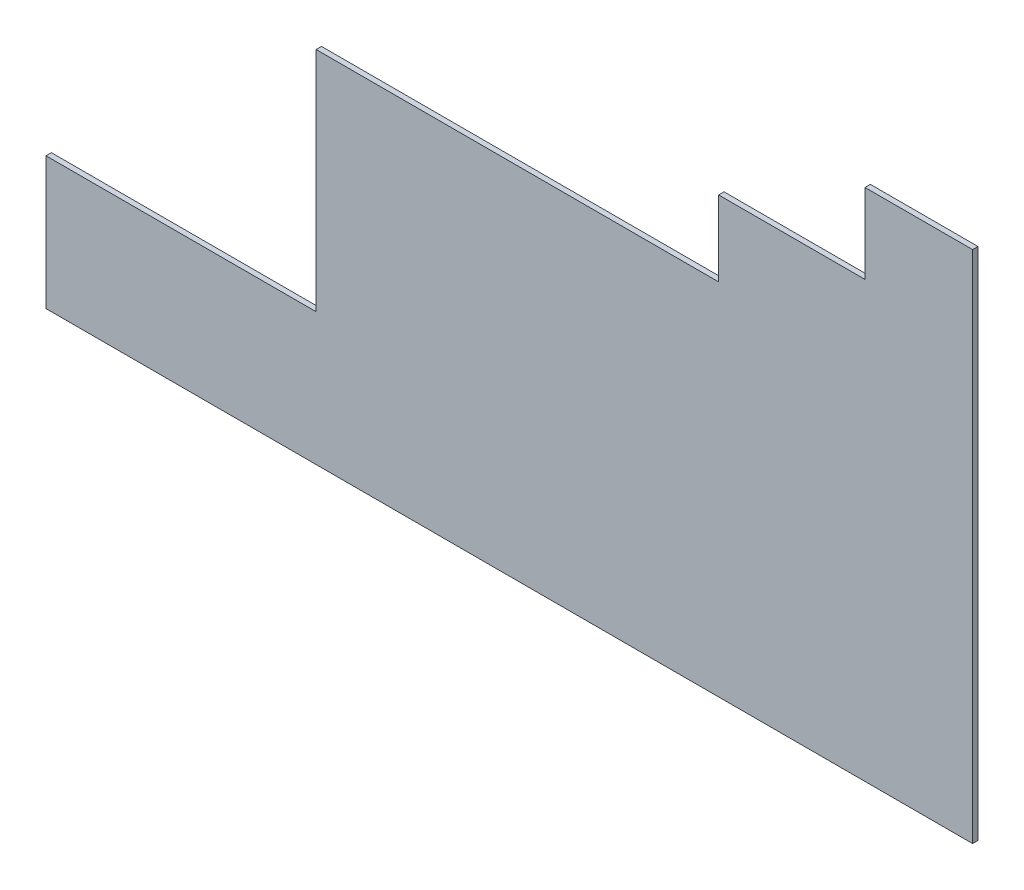
from build123d import *

# Parameters (mm, degrees)
TABAN_FLAN_1_DEPTH         = 25
KES_EKSTR_ZYON1_DEPTH      = 6508.676543898
KES_EKSTR_ZYON1_DEPTH_BACK = 6508.676543898
IZIM7_W                    = 1400
IZIM7_H                    = 1895
IZIM7_W_2                  = 310
IZIM7_H_2                  = 495
KES_EKSTR_ZYON2_DEPTH      = 6508.676543898
KES_EKSTR_ZYON2_DEPTH_BACK = 6508.676543898
IZIM8_W                    = 292
IZIM8_H                    = 2515
KES_EKSTR_ZYON3_DEPTH      = 6240.38698912
KES_EKSTR_ZYON3_DEPTH_BACK = 6240.38698912
IZIM10_W                   = 2900
IZIM10_H                   = 350
KES_EKSTR_ZYON4_DEPTH      = 6240.38698912
KES_EKSTR_ZYON4_DEPTH_BACK = 6240.38698912
KES_EKSTR_ZYON5_DEPTH      = 6191.05856192
KES_EKSTR_ZYON5_DEPTH_BACK = 6191.05856192
IZIM12_W                   = 5
IZIM12_H                   = 615


# Sheet-metal steps are written as plain solids
with BuildPart() as part:
    # Çizim1 → Taban-Flanş1 (new body)
    with BuildSketch(Plane.XY):
        Polygon((0, 0), (0, 1895), (2935, 1895), (2935, 2020), (4900, 2020), (4900, 2515), (6002, 2515), (6002, 0), align=None)
    extrude(amount=-TABAN_FLAN_1_DEPTH)

    # Çizim7 → Kes-Ekstrüzyon1 (cut, two sides: drawn at the far end of the back side and taken through both)
    with BuildSketch(Plane.XY.offset(-KES_EKSTR_ZYON1_DEPTH_BACK)):
        with Locations((700, 947.5)):
            Rectangle(IZIM7_W, IZIM7_H)
        with Locations((5055, 2267.5)):
            Rectangle(IZIM7_W_2, IZIM7_H_2)
    extrude(amount=KES_EKSTR_ZYON1_DEPTH + KES_EKSTR_ZYON1_DEPTH_BACK, mode=Mode.SUBTRACT)

    # Çizim8 → Kes-Ekstrüzyon2 (cut, two sides: drawn at the far end of the back side and taken through both)
    with BuildSketch(Plane.XY.offset(-KES_EKSTR_ZYON2_DEPTH_BACK)):
        with Locations((5856, 1257.5)):
            Rectangle(IZIM8_W, IZIM8_H)
    extrude(amount=KES_EKSTR_ZYON2_DEPTH + KES_EKSTR_ZYON2_DEPTH_BACK, mode=Mode.SUBTRACT)

    # Çizim10 → Kes-Ekstrüzyon3 (cut, two sides: drawn at the far end of the back side and taken through both)
    with BuildSketch(Plane.XY.offset(-KES_EKSTR_ZYON3_DEPTH_BACK)):
        with Locations((2850, 1845)):
            Rectangle(IZIM10_W, IZIM10_H)
    extrude(amount=KES_EKSTR_ZYON3_DEPTH + KES_EKSTR_ZYON3_DEPTH_BACK, mode=Mode.SUBTRACT)

    # Çizim11 → Kes-Ekstrüzyon4 (cut, two sides: drawn at the far end of the back side and taken through both)
    with BuildSketch(Plane.XY.offset(-KES_EKSTR_ZYON4_DEPTH_BACK)):
        Polygon((4300, 1670), (4530, 1670), (4530, 2020), (5210, 2020), (5210, 2390), (5710, 2390), (5778.630385148, 2406.496682207), (5749.815338653, 2697.266696836), (5189.231706845, 2697.266696836), (4530, 2199.552257381), (4300, 2199.552257381), align=None)
    extrude(amount=KES_EKSTR_ZYON4_DEPTH + KES_EKSTR_ZYON4_DEPTH_BACK, mode=Mode.SUBTRACT)

    # Çizim12 → Kes-Ekstrüzyon5 (cut, two sides: drawn at the far end of the back side and taken through both)
    with BuildSketch(Plane.XY.offset(-KES_EKSTR_ZYON5_DEPTH_BACK)):
        Polygon((2660, 1670), (1400, 1670), (1400, 615), (1405, 615), (2660, 615), align=None)
        with Locations((1402.5, 307.5)):
            Rectangle(IZIM12_W, IZIM12_H)
    extrude(amount=KES_EKSTR_ZYON5_DEPTH + KES_EKSTR_ZYON5_DEPTH_BACK, mode=Mode.SUBTRACT)


solid = part.part
